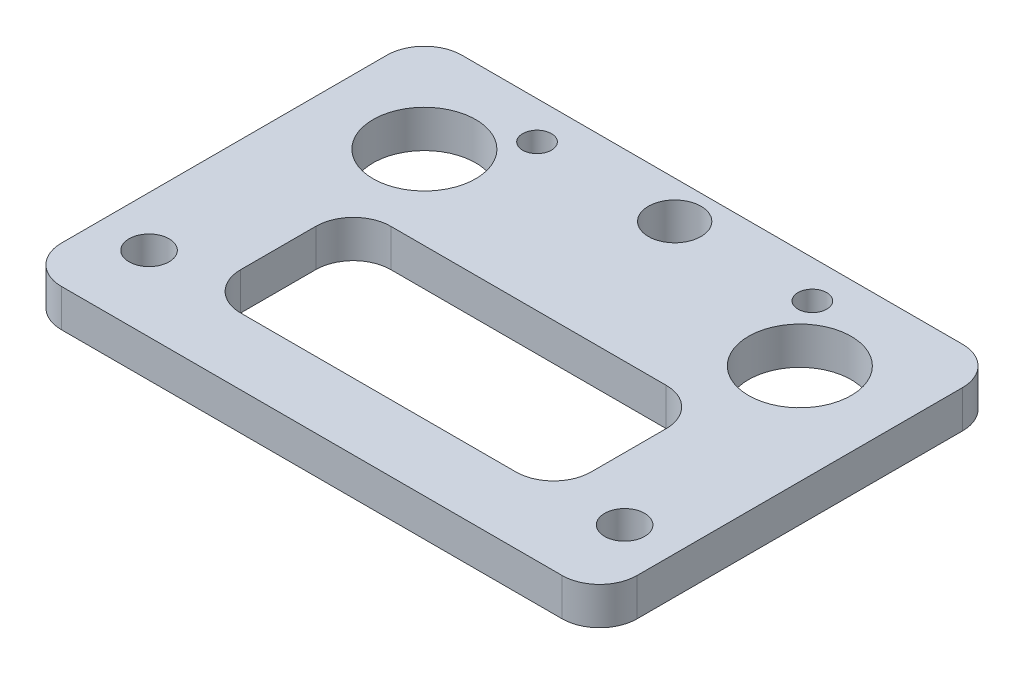
from build123d import *

# Parameters (mm, degrees)
SKETCH_4_W          = 46
SKETCH_4_H          = 16
EXTRUDE_3_DEPTH     = 3
CUT_EXTRUDE_1_REACH = 26.536
SKETCH_5_R          = 4.1
SKETCH_6_W          = 46
SKETCH_6_H          = 3
EXTRUDE_4_DEPTH     = 16
CUT_EXTRUDE_2_REACH = 35.377
SKETCH_9_R          = 1.6
CUT_EXTRUDE_4_REACH = 35.377
SKETCH_11_R         = 1.15
SKETCH_11_R_2       = 2.1
CUT_EXTRUDE_5_REACH = 35.377
SKETCH_12_W         = 28
SKETCH_12_H         = 12
FILLET_3_R          = 3


with BuildPart() as part:
    # 草图4 → 凸台-拉伸3 (new body)
    with BuildSketch(Plane(origin=(0, 0, 0), x_dir=(1, 0, 0), z_dir=(0, 1, 0))):
        Rectangle(SKETCH_4_W, SKETCH_4_H)
    extrude(amount=EXTRUDE_3_DEPTH)

    # 草图5 → 切除-拉伸1 (cut, up to next)
    with BuildSketch(Plane(origin=(0, 3, 0), x_dir=(1, 0, 0), z_dir=(0, 1, 0)), mode=Mode.PRIVATE) as cut_extrude_1_sk1:
        with Locations((-15, 0)):
            Circle(SKETCH_5_R)
    cut_extrude_1_tool1 = extrude(cut_extrude_1_sk1.sketch, amount=-CUT_EXTRUDE_1_REACH, mode=Mode.PRIVATE) & part.part
    # 草图5 → 切除-拉伸1 (cut, up to next)
    with BuildSketch(Plane(origin=(0, 3, 0), x_dir=(1, 0, 0), z_dir=(0, 1, 0)), mode=Mode.PRIVATE) as cut_extrude_1_sk2:
        with Locations((15, 0)):
            Circle(SKETCH_5_R)
    cut_extrude_1_tool2 = extrude(cut_extrude_1_sk2.sketch, amount=-CUT_EXTRUDE_1_REACH, mode=Mode.PRIVATE) & part.part
    add(cut_extrude_1_tool1.solids().sort_by_distance((-15, 3, 0))[0], mode=Mode.SUBTRACT)
    add(cut_extrude_1_tool2.solids().sort_by_distance((15, 3, 0))[0], mode=Mode.SUBTRACT)

    # 草图6 → 凸台-拉伸4 (add)
    with BuildSketch(Plane.XY.offset(8)):
        with Locations((0, 1.5)):
            Rectangle(SKETCH_6_W, SKETCH_6_H)
    extrude(amount=EXTRUDE_4_DEPTH)

    # 草图9 → 切除-拉伸2 (cut, up to next)
    with BuildSketch(Plane(origin=(0, 3, 0), x_dir=(1, 0, 0), z_dir=(0, 1, 0)), mode=Mode.PRIVATE) as cut_extrude_2_sk1:
        with Locations((-19, -18)):
            Circle(SKETCH_9_R)
    cut_extrude_2_tool1 = extrude(cut_extrude_2_sk1.sketch, amount=-CUT_EXTRUDE_2_REACH, mode=Mode.PRIVATE) & part.part
    # 草图9 → 切除-拉伸2 (cut, up to next)
    with BuildSketch(Plane(origin=(0, 3, 0), x_dir=(1, 0, 0), z_dir=(0, 1, 0)), mode=Mode.PRIVATE) as cut_extrude_2_sk2:
        with Locations((19, -18)):
            Circle(SKETCH_9_R)
    cut_extrude_2_tool2 = extrude(cut_extrude_2_sk2.sketch, amount=-CUT_EXTRUDE_2_REACH, mode=Mode.PRIVATE) & part.part
    add(cut_extrude_2_tool1.solids().sort_by_distance((-19, 3, 18))[0], mode=Mode.SUBTRACT)
    add(cut_extrude_2_tool2.solids().sort_by_distance((19, 3, 18))[0], mode=Mode.SUBTRACT)

    # 草图11 → 切除-拉伸4 (cut, up to next)
    with BuildSketch(Plane(origin=(0, 3, 0), x_dir=(1, 0, 0), z_dir=(0, 1, 0)), mode=Mode.PRIVATE) as cut_extrude_4_sk1:
        with Locations((-11, 5)):
            Circle(SKETCH_11_R)
    cut_extrude_4_tool1 = extrude(cut_extrude_4_sk1.sketch, amount=-CUT_EXTRUDE_4_REACH, mode=Mode.PRIVATE) & part.part
    # 草图11 → 切除-拉伸4 (cut, up to next)
    with BuildSketch(Plane(origin=(0, 3, 0), x_dir=(1, 0, 0), z_dir=(0, 1, 0)), mode=Mode.PRIVATE) as cut_extrude_4_sk2:
        with Locations((11, 5)):
            Circle(SKETCH_11_R)
    cut_extrude_4_tool2 = extrude(cut_extrude_4_sk2.sketch, amount=-CUT_EXTRUDE_4_REACH, mode=Mode.PRIVATE) & part.part
    # 草图11 → 切除-拉伸4 (cut, up to next)
    with BuildSketch(Plane(origin=(0, 3, 0), x_dir=(1, 0, 0), z_dir=(0, 1, 0)), mode=Mode.PRIVATE) as cut_extrude_4_sk3:
        with Locations((0, 5)):
            Circle(SKETCH_11_R_2)
    cut_extrude_4_tool3 = extrude(cut_extrude_4_sk3.sketch, amount=-CUT_EXTRUDE_4_REACH, mode=Mode.PRIVATE) & part.part
    add(cut_extrude_4_tool1.solids().sort_by_distance((-11, 3, -5))[0], mode=Mode.SUBTRACT)
    add(cut_extrude_4_tool2.solids().sort_by_distance((11, 3, -5))[0], mode=Mode.SUBTRACT)
    add(cut_extrude_4_tool3.solids().sort_by_distance((0, 3, -5))[0], mode=Mode.SUBTRACT)

    # 草图12 → 切除-拉伸5 (cut, up to next)
    with BuildSketch(Plane(origin=(0, 3, 0), x_dir=(1, 0, 0), z_dir=(0, 1, 0)), mode=Mode.PRIVATE) as cut_extrude_5_sk1:
        with Locations((0, -12.680818863)):
            Rectangle(SKETCH_12_W, SKETCH_12_H)
    cut_extrude_5_tool1 = extrude(cut_extrude_5_sk1.sketch, amount=-CUT_EXTRUDE_5_REACH, mode=Mode.PRIVATE) & part.part
    add(cut_extrude_5_tool1.solids().sort_by_distance((0, 3, 12.680819))[0], mode=Mode.SUBTRACT)

    # 圆角3
    fillet_3_edges = [part.edges().sort_by_distance(p)[0] for p in [
        (-23, 1.5, 24),
        (23, 1.5, 24),
        (23, 1.5, -8),
        (-23, 1.5, -8),
        (14, 1.5, 18.680818863),
        (14, 1.5, 6.680818863),
        (-14, 1.5, 18.680818863),
        (-14, 1.5, 6.680818863),
    ]]
    fillet(fillet_3_edges, radius=FILLET_3_R)


solid = part.part
